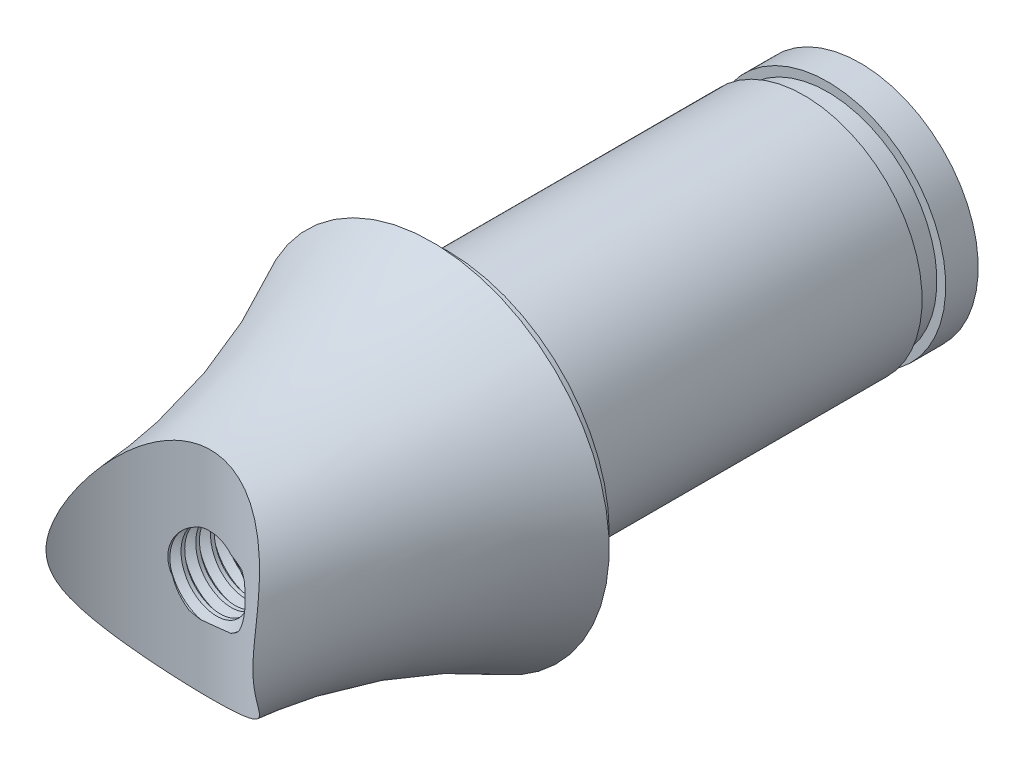
from build123d import *

# Parameters (mm, degrees)
SKETCH1_R               = 4
BOSS_EXTRUDE1_DEPTH     = 14.5
SKETCH2_R               = 6
BOSS_EXTRUDE2_DEPTH     = 10
SKETCH4_R               = 1.25
CUT_EXTRUDE1_DEPTH      = 10
THREAD1_PITCH           = 0.5
SKETCH8_R               = 3
CUT_EXTRUDE2_DEPTH      = 2.5
CUT_EXTRUDE3_START      = -1.1
SKETCH9_R               = 4
SKETCH9_R_2             = 3.7
CUT_EXTRUDE3_DEPTH      = 0.8
CUT_EXTRUDE4_DEPTH      = 26.927784466
CUT_EXTRUDE4_DEPTH_BACK = 26.927784466
SKETCH10_R              = 4
BOSS_EXTRUDE3_START     = 0.5
SKETCH11_R              = 5.5
SKETCH11_R_2            = 4
BOSS_EXTRUDE3_DEPTH     = 0.5


with BuildPart() as part:
    # Sketch1 → Boss-Extrude1 (new body)
    with BuildSketch(Plane.XY):
        with Locations(Location((0, 0, 0), (0, 0, 180))):
            Circle(SKETCH1_R)
    extrude(amount=BOSS_EXTRUDE1_DEPTH)

    # Sketch2 → Boss-Extrude2 (add)
    with BuildSketch(Plane.XY.offset(14.5)):
        Circle(SKETCH2_R)
    extrude(amount=BOSS_EXTRUDE2_DEPTH)

    # Sketch4 → Cut-Extrude1 (cut)
    with BuildSketch(Plane.XY.offset(24.5)):
        Circle(SKETCH4_R)
    extrude(amount=-CUT_EXTRUDE1_DEPTH, mode=Mode.SUBTRACT)

    # Thread1: arcs per turn and ends read off the stored shape
    # Thread1: the profile of Thread Profile1 profile screwed along a right-hand helix through 20 turns, 6 arcs to a turn; built about Z, then put on its axis
    thread1_z = Axis((0, 0, 0), (0, 0, 1))
    thread1_corners = [(1.2497, 0, -0.000173205), (1.520632938, 0, 0.156249999), (1.520632937, 0, 0.218749999), (1.2497, 0, 0.375173204)]
    with BuildLine(mode=Mode.PRIVATE) as thread1_profile:
        Line(thread1_corners[0], thread1_corners[1])
        Line(thread1_corners[1], thread1_corners[2])
        Line(thread1_corners[2], thread1_corners[3])
        Line(thread1_corners[3], thread1_corners[0])
    thread1_cap = Face(thread1_profile.wire())
    thread1_turn_angles = [0, 30, 60, 90, 120, 150, 180, 210, 240, 270, 300, 330, 360]
    thread1_turn_weights = [1, 0.8660254037844387, 1, 0.8660254037844387, 1, 0.8660254037844387, 1, 0.8660254037844387, 1, 0.8660254037844387, 1, 0.8660254037844387, 1]
    thread1_turn_rails = [Edge.make_bspline([Vector(p[0], p[1], 0).rotate(thread1_z, thread1_turn_angles[k]) / thread1_turn_weights[k] + Vector(0, 0, p[2] + THREAD1_PITCH * thread1_turn_angles[k] / 360) for k in range(13)], [0, 0, 0, 1, 1, 2, 2, 3, 3, 4, 4, 5, 5, 6, 6, 6], 2, thread1_turn_weights) for p in thread1_corners]
    thread1_turn_sides = [Face.make_surface_from_curves(thread1_turn_rails[p[0]], thread1_turn_rails[p[1]]) for p in [(0, 1), (1, 2), (2, 3), (3, 0)]]
    thread1 = Plane(origin=(0, 0, 14.5), x_dir=(1, 0, 0), z_dir=(0, 0, 1)) * Solid(Shell([*[p.moved(Location((0, 0, THREAD1_PITCH * i))) for i in range(20) for p in thread1_turn_sides], thread1_cap, thread1_cap.rotate(thread1_z, 7200).moved(Location((0, 0, THREAD1_PITCH * 7200 / 360)))]))
    add(thread1, mode=Mode.SUBTRACT)

    # Sketch8 → Cut-Extrude2 (cut)
    with BuildSketch(Plane(origin=(0, 0, 0), x_dir=(-1, 0, 0), z_dir=(0, 0, -1))):
        Circle(SKETCH8_R)
    extrude(amount=-CUT_EXTRUDE2_DEPTH, mode=Mode.SUBTRACT)

    # Sketch9 → Cut-Extrude3 (cut)
    with BuildSketch(Plane(origin=(0, 0, 0), x_dir=(-1, 0, 0), z_dir=(0, 0, -1)).offset(CUT_EXTRUDE3_START)):
        Circle(SKETCH9_R)
        Circle(SKETCH9_R_2, mode=Mode.SUBTRACT)
    extrude(amount=-CUT_EXTRUDE3_DEPTH, mode=Mode.SUBTRACT)

    # Sketch10 → Cut-Extrude4 (cut, two sides: drawn at the far end of the back side and taken through both)
    with BuildSketch(Plane(origin=(0, 0, 0), x_dir=(1, 0, 0), z_dir=(0, 1, 0)).offset(-CUT_EXTRUDE4_DEPTH_BACK)):
        with Locations((0, -26)):
            Circle(SKETCH10_R)
    extrude(amount=CUT_EXTRUDE4_DEPTH + CUT_EXTRUDE4_DEPTH_BACK, mode=Mode.SUBTRACT)

    # Sketch11 → Boss-Extrude3 (add)
    with BuildSketch(Plane(origin=(0, 0, 14.5), x_dir=(-1, 0, 0), z_dir=(0, 0, -1)).offset(BOSS_EXTRUDE3_START)):
        with Locations(Location((0, 0, 0), (0, 0, 180))):
            Circle(SKETCH11_R)
        Circle(SKETCH11_R_2, mode=Mode.SUBTRACT)
    extrude(amount=-BOSS_EXTRUDE3_DEPTH)

    # Sketch12 → Cut-Revolve1 (revolve, cut)
    with BuildSketch(Plane(origin=(0, 0, 0), x_dir=(1, 0, 0), z_dir=(0, 1, 0))):
        with BuildLine():
            Line((-6, -14.5), (-6, -24.5))
            Line((-6, -24.5), (-3.5, -24.5))
            ThreePointArc((-3.5, -24.5), (-4.134471872, -19.346117968), (-6, -14.5))
        make_face()
    revolve(axis=Axis((0, 0, 11.381203171), (0, 0, 1)), mode=Mode.SUBTRACT)


solid = part.part
